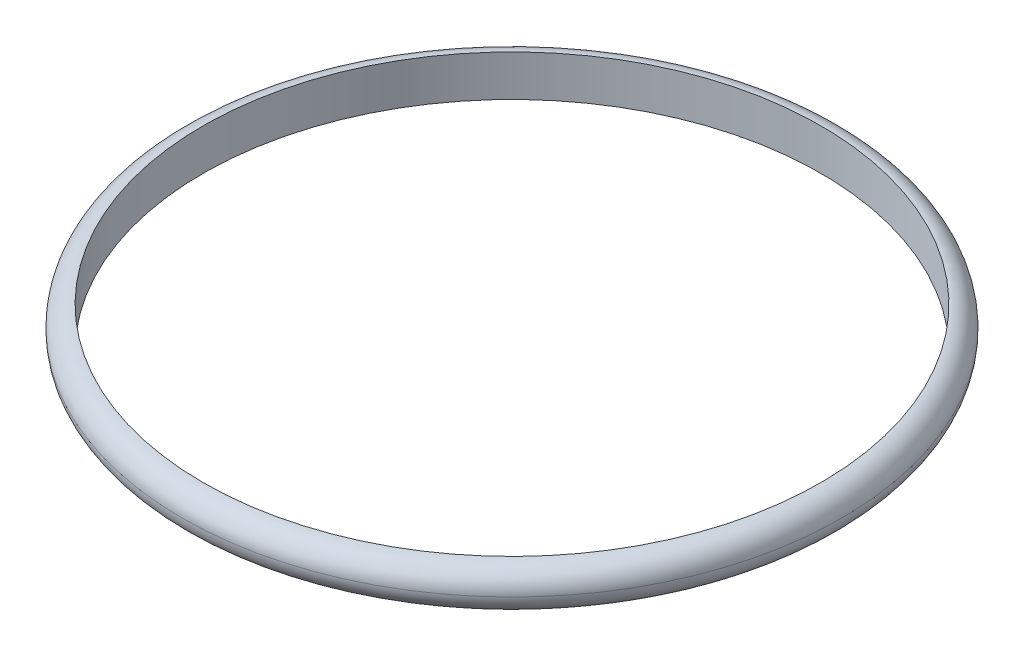
from build123d import *

# Parameters (mm, degrees)
ESQUISSE1_R      = 32
ESQUISSE1_R_2    = 30
EXTRUSION1_DEPTH = 4
CONG_1_R         = 2


with BuildPart() as part:
    # Esquisse1 → Extrusion1 (new body)
    with BuildSketch(Plane(origin=(0, 0, 0), x_dir=(1, 0, 0), z_dir=(0, 1, 0))):
        with Locations(Location((0, 0, 0), (0, 0, 270))):
            Circle(ESQUISSE1_R)
        with Locations(Location((0, 0, 0), (0, 0, 270))):
            Circle(ESQUISSE1_R_2, mode=Mode.SUBTRACT)
    extrude(amount=EXTRUSION1_DEPTH)

    # Congé1
    cong_1_edges = [part.edges().sort_by_distance(p)[0] for p in [
        (0, 0, -32),
        (0, 4, -32),
    ]]
    fillet(cong_1_edges, radius=CONG_1_R - 0.0001)  # a hair under: the kernel refuses the full size


solid = part.part
